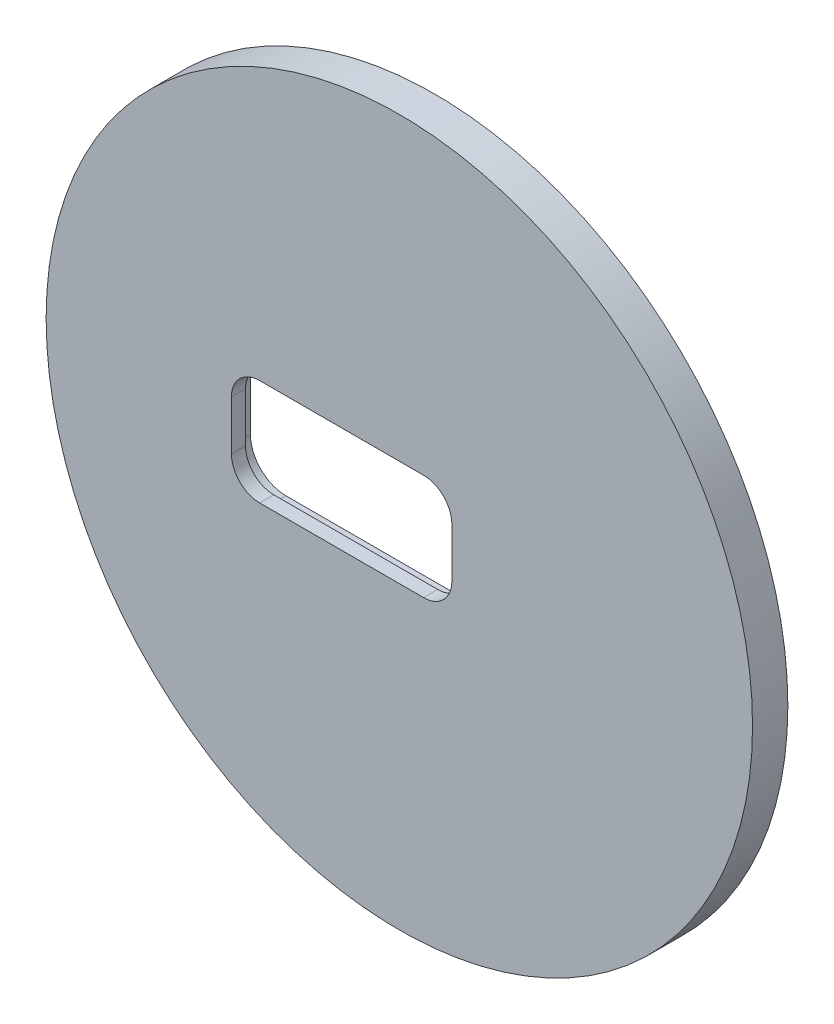
from build123d import *

# Parameters (mm, degrees)
SKETCH3_R           = 63.5
BOSS_EXTRUDE1_DEPTH = 6.35
SKETCH2_W           = 45.483999964
SKETCH2_H           = 24.8
CUT_EXTRUDE1_DEPTH  = 3.81
FILLET1_R           = 6.35
SKETCH6_W           = 39.624
SKETCH6_H           = 19.05
CUT_EXTRUDE2_DEPTH  = 6.35
FILLET2_R           = 5.08
SKETCH3_4_R         = 57.15
SKETCH3_4_W         = 60.426788384
SKETCH3_4_H         = 37.666233726
CUT_EXTRUDE4_DEPTH  = 3.81
FILLET3_R           = 5.08


with BuildPart() as part:
    # Sketch3 → Boss-Extrude1 (new body)
    with BuildSketch(Plane.XY):
        Circle(SKETCH3_R)
    extrude(amount=BOSS_EXTRUDE1_DEPTH)

    # Sketch2 → Cut-Extrude1 (cut)
    with BuildSketch(Plane.XY):
        with Locations((-10.372000084, -0.034999965)):
            Rectangle(SKETCH2_W, SKETCH2_H)
    extrude(amount=CUT_EXTRUDE1_DEPTH, mode=Mode.SUBTRACT)

    # Fillet1
    fillet1_edges = [part.edges().sort_by_distance(p)[0] for p in [
        (-33.114000066, 12.365000035, 1.905),
        (12.369999898, 12.365000035, 1.905),
        (-33.114000066, -12.434999965, 1.905),
        (12.369999898, -12.434999965, 1.905),
    ]]
    fillet(fillet1_edges, radius=FILLET1_R)

    # Sketch6 → Cut-Extrude2 (cut)
    with BuildSketch(Plane.XY):
        with Locations((-10.372000084, -0.034999965)):
            Rectangle(SKETCH6_W, SKETCH6_H)
    extrude(amount=CUT_EXTRUDE2_DEPTH, mode=Mode.SUBTRACT)

    # Fillet2
    fillet2_edges = [part.edges().sort_by_distance(p)[0] for p in [
        (-30.184000084, -9.559999965, 5.08),
        (-30.184000084, 9.490000035, 5.08),
        (9.439999916, 9.490000035, 5.08),
        (9.439999916, -9.559999965, 5.08),
    ]]
    fillet(fillet2_edges, radius=FILLET2_R)

    # Sketch3<4> → Cut-Extrude4 (cut)
    with BuildSketch(Plane.XY):
        Circle(SKETCH3_4_R)
        with Locations((-10.372000084, -0.034999965)):
            Rectangle(SKETCH3_4_W, SKETCH3_4_H, mode=Mode.SUBTRACT)
    extrude(amount=CUT_EXTRUDE4_DEPTH, mode=Mode.SUBTRACT)

    # Fillet3
    fillet3_edges = [part.edges().sort_by_distance(p)[0] for p in [
        (19.841394108, -18.868116828, 1.905),
        (19.841394108, 18.798116898, 1.905),
        (-40.585394276, -18.868116828, 1.905),
        (-40.585394276, 18.798116898, 1.905),
    ]]
    fillet(fillet3_edges, radius=FILLET3_R)


solid = part.part
